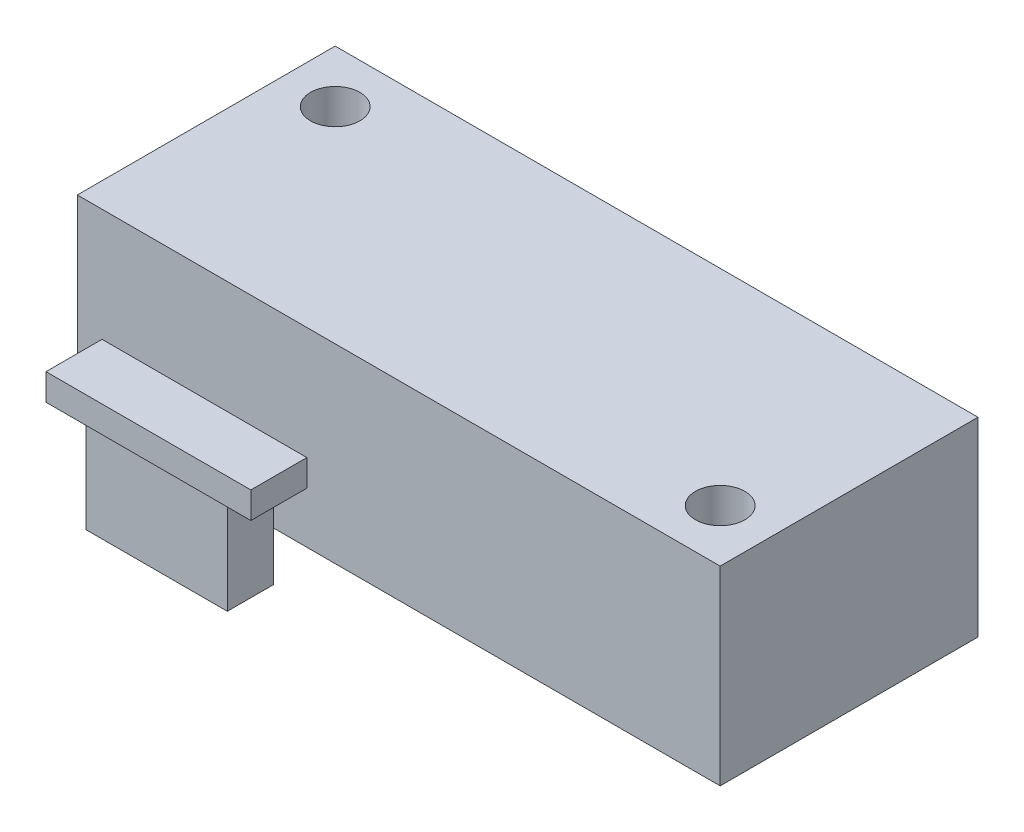
from build123d import *

# Parameters (mm, degrees)
SKETCH1_W           = 27.1018
SKETCH1_H           = 10.8712
SKETCH1_R           = 1.0414
BOSS_EXTRUDE4_DEPTH = 8.0264
SKETCH5_W           = 8.636
SKETCH5_H           = 2.3622
BOSS_EXTRUDE6_DEPTH = 1.1176
SKETCH6_W           = 5.969
SKETCH6_H           = 1.9558
BOSS_EXTRUDE7_DEPTH = 4.1656
SKETCH7_W           = 0.227948718
SKETCH7_H           = 2.54
CUT_EXTRUDE1_DEPTH  = 2.286


with BuildPart() as part:
    # Sketch1 → Boss-Extrude4 (new body)
    with BuildSketch(Plane(origin=(0, 0, 0), x_dir=(1, 0, 0), z_dir=(0, 1, 0))):
        with Locations((13.5509, 5.4356)):
            Rectangle(SKETCH1_W, SKETCH1_H)
        with Locations((2.2098, 8.6614)):
            Circle(SKETCH1_R, mode=Mode.SUBTRACT)
        with Locations((24.892, 2.2098)):
            Circle(SKETCH1_R, mode=Mode.SUBTRACT)
    extrude(amount=BOSS_EXTRUDE4_DEPTH)

    # Sketch5 → Boss-Extrude6 (add)
    with BuildSketch(Plane.XZ.offset(-2.159)):
        with Locations((5.3594, 1.1811)):
            Rectangle(SKETCH5_W, SKETCH5_H)
    extrude(amount=-BOSS_EXTRUDE6_DEPTH)

    # Sketch6 → Boss-Extrude7 (add)
    with BuildSketch(Plane.XZ.offset(-2.159)):
        with Locations((5.3467, 1.0287)):
            Rectangle(SKETCH6_W, SKETCH6_H)
    extrude(amount=BOSS_EXTRUDE7_DEPTH)

    # Sketch7 → Cut-Extrude1 (cut)
    # profile 1 of 12: a face of its own
    with BuildSketch(Plane.XZ):
        Polygon((5.244862276, -1.594756442), (5.244862276, -1.334243621), (6.579990481, -1.334243621), (6.579990481, -1.594756442), (6.026400737, -1.594756442), (6.026400737, -3.874243621), (5.798452019, -3.874243621), (5.798452019, -1.594756442), align=None)
    # profile 2 of 12: a face of its own
    with BuildSketch(Plane.XZ):
        Polygon((6.970759711, -1.334243621), (7.198708429, -1.334243621), (7.198708429, -2.376294903), (8.501272532, -2.376294903), (8.501272532, -1.334243621), (8.72922125, -1.334243621), (8.72922125, -3.874243621), (8.501272532, -3.874243621), (8.501272532, -2.636807724), (7.198708429, -2.636807724), (7.198708429, -3.874243621), (6.970759711, -3.874243621), align=None)
    # profile 3 of 12: a face of its own
    with BuildSketch(Plane.XZ):
        with Locations((9.49447766, -2.604243621)):
            Rectangle(SKETCH7_W, SKETCH7_H)
    # profile 4 of 12: a face of its own
    with BuildSketch(Plane.XZ):
        with BuildLine():
            Line((9.99922125, -3.38425564), (10.213940801, -3.255525672))
            add(Edge.make_bspline(
                [(10.213940801, -3.255525672), (10.233911179, -3.288955255), (10.272173652, -3.353005044), (10.33600121, -3.439552308), (10.402137666, -3.513112273), (10.471072782, -3.573257011), (10.542385784, -3.62060906), (10.616542212, -3.65413868), (10.693292166, -3.675050845), (10.745524597, -3.677590908), (10.771601058, -3.678859006)],
                knots=[0, 0, 0, 0, 1.272034388, 2.437168799, 3.508375237, 4.49857839, 5.41946034, 6.295179144, 7.148887113, 8, 8, 8, 8], degree=3))
            add(Edge.make_bspline(
                [(10.771601058, -3.678859006), (10.793870951, -3.678238758), (10.838021066, -3.677009114), (10.903017665, -3.665193904), (10.966141602, -3.647042245), (11.02609187, -3.621046483), (11.082041259, -3.589595125), (11.131104404, -3.551606756), (11.173519583, -3.509075395), (11.20821534, -3.461626269), (11.234834566, -3.410596109), (11.255293953, -3.35821699), (11.266647806, -3.303666087), (11.268358136, -3.266937351), (11.26922125, -3.248402275)],
                knots=[0, 0, 0, 0, 1.095163259, 2.171163733, 3.241058638, 4.321873601, 5.38011039, 6.391990106, 7.366004449, 8.327778327, 9.272591725, 10.192022065, 11.087607919, 12, 12, 12, 12], degree=3))
            add(Edge.make_bspline(
                [(11.26922125, -3.248402275), (11.268151322, -3.227254344), (11.265976314, -3.184263691), (11.247592897, -3.120836514), (11.218673729, -3.05806762), (11.191994553, -3.019240988), (11.178143526, -2.999083365)],
                knots=[0, 0, 0, 0, 0.938893495, 1.908633276, 2.914225137, 4, 4, 4, 4], degree=3))
            add(Edge.make_bspline(
                [(11.178143526, -2.999083365), (11.166771137, -2.984535098), (11.14289623, -2.953992833), (11.101851635, -2.908530291), (11.053688798, -2.861635781), (11.000055932, -2.811518637), (10.938999348, -2.760509779), (10.87243138, -2.7061768), (10.798652465, -2.650585941), (10.746909402, -2.613304136), (10.720210833, -2.594067339)],
                knots=[0, 0, 0, 0, 0.722233717, 1.516239348, 2.393582979, 3.351407094, 4.387010283, 5.505090956, 6.712668013, 8, 8, 8, 8], degree=3))
            add(Edge.make_bspline(
                [(10.720210833, -2.594067339), (10.693487133, -2.575032878), (10.642393454, -2.538640439), (10.570940654, -2.484629673), (10.507045529, -2.435249265), (10.450992072, -2.390034353), (10.402804936, -2.348978806), (10.362104403, -2.312476873), (10.329927279, -2.279541374), (10.312034372, -2.258175372), (10.304000897, -2.248582563)],
                knots=[0, 0, 0, 0, 1.452282411, 2.77665338, 3.964542531, 5.026858415, 5.96415736, 6.766646006, 7.446254459, 8, 8, 8, 8], degree=3))
            add(Edge.make_bspline(
                [(10.304000897, -2.248582563), (10.29277225, -2.233632097), (10.270689609, -2.204229997), (10.241540565, -2.158274243), (10.216765287, -2.111231074), (10.19734348, -2.062974075), (10.180988624, -2.014180726), (10.169988297, -1.964214394), (10.163100255, -1.913299282), (10.16239487, -1.87903577), (10.162041763, -1.861883845)],
                knots=[0, 0, 0, 0, 1.068054152, 2.10047183, 3.106115577, 4.101338837, 5.06977816, 6.043150881, 7.020423561, 8, 8, 8, 8], degree=3))
            add(Edge.make_bspline(
                [(10.162041763, -1.861883845), (10.162988972, -1.835010809), (10.164863143, -1.781839129), (10.180713119, -1.704165326), (10.20573059, -1.630007183), (10.24077888, -1.560098884), (10.285959931, -1.496260715), (10.338244723, -1.437758356), (10.400519345, -1.388577727), (10.468847249, -1.345606691), (10.54363673, -1.311972791), (10.622007271, -1.286601108), (10.704083432, -1.272225247), (10.759675421, -1.270162212), (10.787883109, -1.269115416)],
                knots=[0, 0, 0, 0, 1.005424448, 1.989358655, 2.955360095, 3.929531133, 4.905563448, 5.876582895, 6.856512386, 7.866279853, 8.892233794, 9.918561126, 10.94386622, 12, 12, 12, 12], degree=3))
            add(Edge.make_bspline(
                [(10.787883109, -1.269115416), (10.817814542, -1.270147782), (10.877338608, -1.272200829), (10.964895468, -1.290051608), (11.049194959, -1.319588667), (11.117008071, -1.353108436), (11.170081561, -1.386586664), (11.21055663, -1.41708105), (11.251572151, -1.452187558), (11.293458968, -1.491999696), (11.335507332, -1.536882767), (11.378341495, -1.586529381), (11.422061621, -1.640636139), (11.450187303, -1.67926192), (11.464605865, -1.699063333)],
                knots=[0, 0, 0, 0, 1.286793592, 2.559021753, 3.825965368, 5.121522368, 5.803751409, 6.523245864, 7.299691795, 8.125521123, 9.008227632, 9.944561021, 10.946284179, 12, 12, 12, 12], degree=3))
            Line((11.464605865, -1.699063333), (11.258536154, -1.855269262))
            add(Edge.make_bspline(
                [(11.258536154, -1.855269262), (11.246093106, -1.839239184), (11.222130704, -1.808369001), (11.185751019, -1.765137247), (11.151462001, -1.72564643), (11.117679711, -1.691345451), (11.086188332, -1.660355903), (11.055623393, -1.633823965), (11.02642475, -1.611489676), (10.989618763, -1.587654635), (10.943377905, -1.564027916), (10.885331984, -1.544035156), (10.82467223, -1.532020911), (10.783357583, -1.530432404), (10.762442404, -1.529628237)],
                knots=[0, 0, 0, 0, 1.181633172, 2.275549214, 3.290209073, 4.226197932, 5.078386478, 5.862611352, 6.581680152, 7.217281963, 8.414376989, 9.595101626, 10.782541182, 12, 12, 12, 12], degree=3))
            add(Edge.make_bspline(
                [(10.762442404, -1.529628237), (10.736203099, -1.530507584), (10.685603071, -1.532203324), (10.613764443, -1.550723542), (10.549107709, -1.579884092), (10.493552419, -1.620752676), (10.447297584, -1.669173054), (10.413838194, -1.724892566), (10.393699503, -1.786420367), (10.391242031, -1.829340311), (10.389990481, -1.851198749)],
                knots=[0, 0, 0, 0, 1.14458467, 2.207223713, 3.21896685, 4.227309161, 5.202851033, 6.127160689, 7.046193047, 8, 8, 8, 8], degree=3))
            add(Edge.make_bspline(
                [(10.389990481, -1.851198749), (10.390275778, -1.864806965), (10.39084684, -1.892045649), (10.398811408, -1.932287538), (10.409043492, -1.972427767), (10.425257859, -2.01228587), (10.447642737, -2.052558919), (10.477037921, -2.093940409), (10.514059011, -2.136795077), (10.542417757, -2.164667857), (10.55739032, -2.179383845)],
                knots=[0, 0, 0, 0, 0.858281714, 1.717966888, 2.583508476, 3.4729293, 4.427298488, 5.488583878, 6.674047936, 8, 8, 8, 8], degree=3))
            add(Edge.make_bspline(
                [(10.55739032, -2.179383845), (10.562950288, -2.184345573), (10.576159498, -2.196133501), (10.600308312, -2.215431899), (10.632198229, -2.23923734), (10.670996512, -2.268692135), (10.71741854, -2.302859825), (10.771469418, -2.341303532), (10.832546645, -2.385271265), (10.875887692, -2.416010737), (10.898804583, -2.432264454)],
                knots=[0, 0, 0, 0, 0.420754252, 0.999615792, 1.744751191, 2.668019286, 3.750313428, 4.999500688, 6.413464383, 8, 8, 8, 8], degree=3))
            add(Edge.make_bspline(
                [(10.898804583, -2.432264454), (10.926371503, -2.452324184), (10.979751023, -2.49116707), (11.055702524, -2.549525878), (11.124568316, -2.606601687), (11.186590184, -2.662030007), (11.242380854, -2.715390395), (11.291321372, -2.767324817), (11.333910408, -2.817461204), (11.37976047, -2.881739588), (11.426611002, -2.960683575), (11.466845696, -3.057405496), (11.492215468, -3.154503398), (11.495533082, -3.219764587), (11.497169968, -3.251963974)],
                knots=[0, 0, 0, 0, 1.163667725, 2.253281268, 3.268753668, 4.215851969, 5.092017293, 5.902905408, 6.650798638, 7.335211899, 8.59617414, 9.77448103, 10.901945474, 12, 12, 12, 12], degree=3))
            add(Edge.make_bspline(
                [(11.497169968, -3.251963974), (11.496693073, -3.274735702), (11.495748545, -3.319836946), (11.484891196, -3.386062058), (11.468983782, -3.450382747), (11.44500819, -3.512003954), (11.415745098, -3.57205301), (11.378613021, -3.628954744), (11.335572587, -3.68396853), (11.286199511, -3.735627407), (11.232173057, -3.783050075), (11.175071175, -3.825235165), (11.114800406, -3.86040932), (11.051687707, -3.889111931), (10.985718583, -3.911560827), (10.91691522, -3.927826166), (10.845164203, -3.937808882), (10.796395854, -3.938845029), (10.771601058, -3.939371826)],
                knots=[0, 0, 0, 0, 0.983748083, 1.948392443, 2.894712957, 3.844097841, 4.80183111, 5.778335162, 6.776009319, 7.81870978, 8.863265674, 9.881300176, 10.883814829, 11.87499822, 12.874611388, 13.892143829, 14.928324115, 16, 16, 16, 16], degree=3))
            add(Edge.make_bspline(
                [(10.771601058, -3.939371826), (10.752416552, -3.939000854), (10.714289149, -3.938263583), (10.657894267, -3.931745739), (10.60263868, -3.922524013), (10.549215744, -3.907883402), (10.496937165, -3.89012011), (10.446030315, -3.868248292), (10.396470521, -3.842037523), (10.347980047, -3.812069133), (10.300682217, -3.777192941), (10.255020661, -3.736572175), (10.209497195, -3.691327152), (10.165455484, -3.6402292), (10.122004688, -3.584103849), (10.080001499, -3.522425984), (10.038576481, -3.455531562), (10.012584685, -3.408458042), (9.99922125, -3.38425564)],
                knots=[0, 0, 0, 0, 0.915332311, 1.819136955, 2.706846663, 3.586547465, 4.459518054, 5.340707479, 6.227863349, 7.133153174, 8.059268498, 9.028702269, 10.047606654, 11.120612155, 12.245963614, 13.433783089, 14.680604001, 16, 16, 16, 16], degree=3))
        make_face()
    # profile 5 of 12: a face of its own
    with BuildSketch(Plane.XZ):
        with BuildLine():
            Line((12.995118686, -1.334243621), (13.493247692, -1.334243621))
            add(Edge.make_bspline(
                [(13.493247692, -1.334243621), (13.527509321, -1.334281283), (13.593156124, -1.334353445), (13.687292193, -1.336541289), (13.772788398, -1.339463517), (13.849460389, -1.343514376), (13.917544072, -1.348301616), (13.976731369, -1.355015953), (14.027487504, -1.362026568), (14.057899613, -1.369154103), (14.071769327, -1.372404679)],
                knots=[0, 0, 0, 0, 1.415646017, 2.712440637, 3.8905458, 4.950247383, 5.884950622, 6.709939814, 7.411656543, 8, 8, 8, 8], degree=3))
            add(Edge.make_bspline(
                [(14.071769327, -1.372404679), (14.08932692, -1.377210322), (14.124028383, -1.386708371), (14.174030855, -1.405732044), (14.221604217, -1.428288816), (14.266911691, -1.453996475), (14.309396517, -1.483957998), (14.349692558, -1.516958852), (14.387444201, -1.553760962), (14.422439154, -1.593951556), (14.454577264, -1.636855937), (14.482248519, -1.683114584), (14.505418564, -1.731948844), (14.525290995, -1.78332475), (14.539593702, -1.837673728), (14.55036831, -1.894618142), (14.557207171, -1.954151888), (14.557862173, -1.994835335), (14.558195609, -2.015545704)],
                knots=[0, 0, 0, 0, 0.999701418, 1.975846123, 2.934577507, 3.890451536, 4.834027766, 5.787354733, 6.749476667, 7.726910423, 8.712836071, 9.690891519, 10.682875813, 11.679750201, 12.712814741, 13.765529915, 14.8625177, 16, 16, 16, 16], degree=3))
            add(Edge.make_bspline(
                [(14.558195609, -2.015545704), (14.557889775, -2.036430148), (14.55729139, -2.077291973), (14.550109515, -2.137071082), (14.540435604, -2.194198142), (14.5255606, -2.248546486), (14.506078312, -2.29979336), (14.483224079, -2.348721911), (14.455658889, -2.39449973), (14.423985212, -2.43729301), (14.388750627, -2.477141917), (14.350104209, -2.513757683), (14.308201979, -2.546925974), (14.263177106, -2.576721149), (14.214590644, -2.602452278), (14.163179481, -2.625499007), (14.108496753, -2.644854577), (14.070656186, -2.655036393), (14.051416763, -2.660213172)],
                knots=[0, 0, 0, 0, 1.121902311, 2.195077645, 3.232258892, 4.234102512, 5.217864754, 6.176164875, 7.132989551, 8.084763148, 9.034132444, 9.988522005, 10.94243251, 11.903244335, 12.886203696, 13.894208494, 14.929344452, 16, 16, 16, 16], degree=3))
            add(Edge.make_bspline(
                [(14.051416763, -2.660213172), (14.035503783, -2.663597164), (14.000629563, -2.67101338), (13.943194559, -2.67929266), (13.876323336, -2.686359376), (13.800107167, -2.691657915), (13.714614465, -2.696193897), (13.619798981, -2.699799314), (13.515474594, -2.701780408), (13.442706319, -2.701882583), (13.404714038, -2.701935929)],
                knots=[0, 0, 0, 0, 0.601384939, 1.31797006, 2.144135048, 3.087295005, 4.142315834, 5.309527816, 6.595305764, 8, 8, 8, 8], degree=3))
            Line((13.404714038, -2.701935929), (13.223067404, -2.701935929))
            Line((13.223067404, -2.701935929), (13.223067404, -3.874243621))
            Line((13.223067404, -3.874243621), (12.995118686, -3.874243621))
            Line((12.995118686, -3.874243621), (12.995118686, -1.334243621))
        make_face()
        with BuildLine():
            Line((13.223067404, -1.594756442), (13.223067404, -2.441423108))
            Line((13.223067404, -2.441423108), (13.667770929, -2.447020063))
            add(Edge.make_bspline(
                [(13.667770929, -2.447020063), (13.689484247, -2.447031286), (13.731401359, -2.44705295), (13.791952218, -2.444160816), (13.848129244, -2.440822144), (13.899759878, -2.435933788), (13.946867397, -2.429024075), (13.989530346, -2.4220487), (14.027417917, -2.41195738), (14.071758481, -2.398369781), (14.121167539, -2.375195825), (14.174919417, -2.341559048), (14.220472928, -2.298683334), (14.259892492, -2.250475708), (14.291175043, -2.196846054), (14.314075678, -2.139464597), (14.32753126, -2.078919815), (14.329335527, -2.037490137), (14.330246891, -2.016563333)],
                knots=[0, 0, 0, 0, 1.160613943, 2.240541288, 3.23993089, 4.169200891, 5.011653406, 5.7853311, 6.478053781, 7.106038997, 8.262395093, 9.384106736, 10.481365981, 11.59014053, 12.70357646, 13.786202915, 14.881775077, 16, 16, 16, 16], degree=3))
            add(Edge.make_bspline(
                [(14.330246891, -2.016563333), (14.32933057, -1.996142811), (14.327509038, -1.955549343), (14.313970212, -1.896056185), (14.291219567, -1.839279417), (14.259682496, -1.786321806), (14.221407504, -1.738287646), (14.176921695, -1.696561159), (14.126329786, -1.663017409), (14.079268498, -1.64136697), (14.037466494, -1.628147885), (14.001157586, -1.618898772), (13.960161497, -1.611514189), (13.91446488, -1.605534664), (13.86442192, -1.600415867), (13.809602686, -1.596942615), (13.750214842, -1.594909558), (13.708986599, -1.594808716), (13.687614679, -1.594756442)],
                knots=[0, 0, 0, 0, 1.120700087, 2.227813068, 3.331159281, 4.466773991, 5.599788987, 6.693661531, 7.80175334, 8.91857717, 9.525282508, 10.207424825, 10.974604443, 11.810962634, 12.737642355, 13.736264703, 14.826523623, 16, 16, 16, 16], degree=3))
            Line((13.687614679, -1.594756442), (13.223067404, -1.594756442))
        make_face(mode=Mode.SUBTRACT)
    # profile 6 of 12: a face of its own
    with BuildSketch(Plane.XZ):
        Polygon((16.121272532, -1.334243621), (17.293580224, -3.874243621), (17.045787756, -3.874243621), (16.670282949, -3.060141057), (15.518836635, -3.060141057), (15.132646731, -3.874243621), (14.883836635, -3.874243621), (16.088708429, -1.334243621), align=None)
        Polygon((16.10244641, -1.829319743), (15.642478461, -2.799628237), (16.55020282, -2.799628237), align=None, mode=Mode.SUBTRACT)
    # profile 7 of 12: a face of its own
    with BuildSketch(Plane.XZ):
        with BuildLine():
            Line((17.74947766, -1.334243621), (18.257782949, -1.334243621))
            add(Edge.make_bspline(
                [(18.257782949, -1.334243621), (18.291703653, -1.334356532), (18.356835164, -1.334573334), (18.450142623, -1.335782202), (18.534925716, -1.33924702), (18.611140114, -1.342228677), (18.678784418, -1.347665686), (18.738066052, -1.35286227), (18.788711981, -1.35966487), (18.819370398, -1.36598252), (18.833251699, -1.36884298)],
                knots=[0, 0, 0, 0, 1.410062039, 2.707475311, 3.878576406, 4.937260626, 5.877586885, 6.699081471, 7.410979367, 8, 8, 8, 8], degree=3))
            add(Edge.make_bspline(
                [(18.833251699, -1.36884298), (18.851834792, -1.373434404), (18.88860455, -1.382519305), (18.941545455, -1.401721415), (18.991992993, -1.423942514), (19.039737608, -1.4500419), (19.084540154, -1.480213311), (19.126862585, -1.513935891), (19.16689695, -1.551025121), (19.20302419, -1.59241612), (19.23708853, -1.63584033), (19.265818562, -1.68279677), (19.290584636, -1.731899708), (19.310302668, -1.783648519), (19.326179826, -1.837541348), (19.337374869, -1.894066361), (19.344088588, -1.95296604), (19.344772106, -1.993140065), (19.345118686, -2.013510448)],
                knots=[0, 0, 0, 0, 1.027469482, 2.033020251, 3.019912614, 3.986113645, 4.951240523, 5.91722682, 6.890402269, 7.87763091, 8.8651537, 9.85103654, 10.82876324, 11.815024772, 12.821070561, 13.842952187, 14.906261191, 16, 16, 16, 16], degree=3))
            add(Edge.make_bspline(
                [(19.345118686, -2.013510448), (19.344052613, -2.04735421), (19.341972429, -2.113392154), (19.322577639, -2.209230623), (19.290808393, -2.298630868), (19.247030921, -2.381480325), (19.19128193, -2.456164051), (19.12428051, -2.521761696), (19.045989283, -2.576654661), (18.973106294, -2.61472041), (18.908725132, -2.639099264), (18.855723814, -2.656252507), (18.79790835, -2.669505476), (18.735832684, -2.681378258), (18.669238488, -2.690342059), (18.598285374, -2.696907302), (18.522922738, -2.701010526), (18.471150957, -2.701621581), (18.444517724, -2.701935929)],
                knots=[0, 0, 0, 0, 1.260483769, 2.459530307, 3.627416485, 4.787058657, 5.939039949, 7.08810263, 8.267026773, 9.491475466, 10.141966685, 10.831826277, 11.566392101, 12.351337768, 13.187381173, 14.07005841, 15.007169909, 16, 16, 16, 16], degree=3))
            Line((18.444517724, -2.701935929), (19.377682788, -3.874243621))
            Line((19.377682788, -3.874243621), (19.095799776, -3.874243621))
            Line((19.095799776, -3.874243621), (18.162634711, -2.701935929))
            Line((18.162634711, -2.701935929), (17.977426378, -2.701935929))
            Line((17.977426378, -2.701935929), (17.977426378, -3.874243621))
            Line((17.977426378, -3.874243621), (17.74947766, -3.874243621))
            Line((17.74947766, -3.874243621), (17.74947766, -1.334243621))
        make_face()
        with BuildLine():
            Line((17.977426378, -1.594756442), (17.977426378, -2.441423108))
            Line((17.977426378, -2.441423108), (18.442482468, -2.444984807))
            add(Edge.make_bspline(
                [(18.442482468, -2.444984807), (18.464195868, -2.444994413), (18.50628262, -2.445013032), (18.567170531, -2.442114692), (18.623863413, -2.438817541), (18.676144416, -2.433774302), (18.724036896, -2.427274752), (18.767516916, -2.419144587), (18.806655451, -2.409672518), (18.852301818, -2.39501191), (18.903273473, -2.371784685), (18.958668304, -2.337991438), (19.005841429, -2.295486991), (19.045696106, -2.246883397), (19.077721465, -2.19344452), (19.100299927, -2.135810926), (19.114627299, -2.075437595), (19.116317158, -2.033942625), (19.117169968, -2.013001634)],
                knots=[0, 0, 0, 0, 1.146690395, 2.22261258, 3.21895312, 4.145990853, 4.996080663, 5.770904154, 6.481378293, 7.121626537, 8.300444488, 9.431385265, 10.535395872, 11.636531494, 12.74115979, 13.810798291, 14.895190096, 16, 16, 16, 16], degree=3))
            add(Edge.make_bspline(
                [(19.117169968, -2.013001634), (19.116297571, -1.992575263), (19.1145688, -1.95209765), (19.100454551, -1.892838789), (19.076586257, -1.836910203), (19.044420976, -1.784539405), (19.005233018, -1.737000957), (18.959282376, -1.696326737), (18.907825463, -1.66276284), (18.859731508, -1.641314804), (18.816744394, -1.628164967), (18.779421155, -1.618911266), (18.737248825, -1.611476708), (18.690022635, -1.605520001), (18.637944195, -1.600400127), (18.580750179, -1.596951694), (18.518820059, -1.594909632), (18.475896286, -1.594808694), (18.453676378, -1.594756442)],
                knots=[0, 0, 0, 0, 1.101028733, 2.181837193, 3.264309656, 4.369019818, 5.486613113, 6.575447106, 7.666700264, 8.788928104, 9.402425223, 10.0903467, 10.862060571, 11.710948788, 12.657782767, 13.684531032, 14.801375019, 16, 16, 16, 16], degree=3))
            Line((18.453676378, -1.594756442), (17.977426378, -1.594756442))
        make_face(mode=Mode.SUBTRACT)
    # profile 8 of 12: a face of its own
    with BuildSketch(Plane.XZ):
        Polygon((19.605631506, -1.594756442), (19.605631506, -1.334243621), (20.940759711, -1.334243621), (20.940759711, -1.594756442), (20.387169968, -1.594756442), (20.387169968, -3.874243621), (20.15922125, -3.874243621), (20.15922125, -1.594756442), align=None)
    # profile 9 of 12: a face of its own
    with BuildSketch(Plane.XZ):
        with BuildLine():
            Line((5.537939199, -9.107576954), (5.537939199, -6.567576954))
            Line((5.537939199, -6.567576954), (6.050823814, -6.567576954))
            add(Edge.make_bspline(
                [(6.050823814, -6.567576954), (6.095432737, -6.567898134), (6.181616944, -6.568518651), (6.306158548, -6.572453032), (6.421390193, -6.57941297), (6.526932897, -6.589550854), (6.623076405, -6.601999056), (6.709551509, -6.617602207), (6.78680535, -6.636026765), (6.834317458, -6.651735177), (6.856785353, -6.659163493)],
                knots=[0, 0, 0, 0, 1.314313732, 2.53924729, 3.670748893, 4.714932338, 5.66265055, 6.526160246, 7.303039223, 8, 8, 8, 8], degree=3))
            add(Edge.make_bspline(
                [(6.856785353, -6.659163493), (6.886172963, -6.670361776), (6.944281771, -6.692504404), (7.027018369, -6.734273834), (7.104905918, -6.781599913), (7.178362097, -6.834545025), (7.245708983, -6.894608295), (7.309577571, -6.959238294), (7.367355113, -7.030785261), (7.420265705, -7.107765395), (7.467971012, -7.189271856), (7.509437716, -7.275149335), (7.543875756, -7.364961709), (7.572463984, -7.458459216), (7.594994841, -7.555847445), (7.610366872, -7.657239793), (7.620505819, -7.762235548), (7.621524759, -7.833482159), (7.622041763, -7.869632243)],
                knots=[0, 0, 0, 0, 0.984719456, 1.947108742, 2.898477687, 3.838006223, 4.779231079, 5.722358779, 6.681677486, 7.655904652, 8.64651281, 9.637519902, 10.640069247, 11.656948941, 12.698408672, 13.768548281, 14.867775369, 16, 16, 16, 16], degree=3))
            add(Edge.make_bspline(
                [(7.622041763, -7.869632243), (7.621585312, -7.901027542), (7.620685828, -7.962895257), (7.612609125, -8.05407465), (7.600869738, -8.14254907), (7.582694806, -8.227897207), (7.560631268, -8.310866828), (7.532354427, -8.390573657), (7.499961809, -8.467748878), (7.462188469, -8.541348989), (7.42072015, -8.611078065), (7.376218084, -8.67681002), (7.32872974, -8.737606895), (7.27780228, -8.793652802), (7.224093823, -8.844863251), (7.167252738, -8.891666027), (7.107132352, -8.933145356), (7.044001942, -8.9709312), (6.976019837, -9.003893401), (6.90189838, -9.031782608), (6.821321468, -9.054894152), (6.734486882, -9.07417703), (6.641244587, -9.08947313), (6.541503166, -9.099724855), (6.435415864, -9.106657555), (6.362569197, -9.107264537), (6.325074615, -9.107576954)],
                knots=[0, 0, 0, 0, 1.105936401, 2.179363191, 3.223086493, 4.248585256, 5.251745608, 6.245858792, 7.225916811, 8.198733463, 9.158002045, 10.082870192, 10.993790845, 11.873723703, 12.748670949, 13.606408763, 14.465103618, 15.319838547, 16.196477973, 17.123216899, 18.106603292, 19.147568657, 20.255746949, 21.433717677, 22.679120308, 24, 24, 24, 24], degree=3))
            Line((6.325074615, -9.107576954), (5.537939199, -9.107576954))
        make_face()
        with BuildLine():
            Line((5.765887917, -8.847064134), (6.057438397, -8.847064134))
            add(Edge.make_bspline(
                [(6.057438397, -8.847064134), (6.099332701, -8.846884087), (6.179910789, -8.84653779), (6.295776878, -8.843499077), (6.40164364, -8.838533785), (6.497526107, -8.831585015), (6.583370142, -8.82239122), (6.659355149, -8.812140576), (6.725232051, -8.799369855), (6.765095128, -8.787794015), (6.783516122, -8.782444743)],
                knots=[0, 0, 0, 0, 1.375205317, 2.645023457, 3.804390687, 4.853969522, 5.800190428, 6.637939096, 7.370582563, 8, 8, 8, 8], degree=3))
            add(Edge.make_bspline(
                [(6.783516122, -8.782444743), (6.806701504, -8.774279326), (6.852518488, -8.758143524), (6.918472189, -8.72871025), (6.979981559, -8.693845434), (7.038118548, -8.65509064), (7.092058464, -8.61107897), (7.142440537, -8.562767453), (7.18916333, -8.509910216), (7.231744113, -8.452572865), (7.26985014, -8.39111227), (7.302849261, -8.326132659), (7.331770086, -8.258346003), (7.354469408, -8.186711356), (7.372260718, -8.111869125), (7.38486252, -8.033814045), (7.39271092, -7.952560692), (7.39362637, -7.897296007), (7.394093045, -7.869123429)],
                knots=[0, 0, 0, 0, 0.998632004, 1.973411704, 2.929992603, 3.868527914, 4.809262121, 5.754881198, 6.702106254, 7.672490631, 8.653608572, 9.636854334, 10.631411391, 11.644891563, 12.686317036, 13.754757253, 14.855430412, 16, 16, 16, 16], degree=3))
            add(Edge.make_bspline(
                [(7.394093045, -7.869123429), (7.393720545, -7.839417417), (7.392988765, -7.781059695), (7.383790837, -7.695432162), (7.37034948, -7.613077633), (7.350912176, -7.533990599), (7.32614291, -7.458016767), (7.29523137, -7.385576322), (7.259913309, -7.315904217), (7.21789203, -7.250608535), (7.171870428, -7.18885525), (7.120796196, -7.132282254), (7.065480774, -7.080760676), (7.006527483, -7.033488146), (6.942274845, -6.992366507), (6.874236452, -6.955582459), (6.801414165, -6.924365212), (6.750750095, -6.907761694), (6.7250025, -6.899323749)],
                knots=[0, 0, 0, 0, 1.122418816, 2.205001699, 3.251619955, 4.274784885, 5.280384055, 6.268708349, 7.249350384, 8.229342522, 9.199999885, 10.157847722, 11.105861043, 12.055065948, 13.010012805, 13.98527497, 14.976112212, 16, 16, 16, 16], degree=3))
            add(Edge.make_bspline(
                [(6.7250025, -6.899323749), (6.703701954, -6.893433542), (6.658411148, -6.880909344), (6.584504794, -6.867247502), (6.501326943, -6.85519738), (6.408508303, -6.84499526), (6.306154678, -6.837674747), (6.19418735, -6.832180136), (6.072557923, -6.82847418), (5.988242598, -6.828221118), (5.944481667, -6.828089775)],
                knots=[0, 0, 0, 0, 0.674548936, 1.434276114, 2.292660221, 3.240891867, 4.284742987, 5.42552168, 6.663806718, 8, 8, 8, 8], degree=3))
            Line((5.944481667, -6.828089775), (5.765887917, -6.828089775))
            Line((5.765887917, -6.828089775), (5.765887917, -8.847064134))
        make_face(mode=Mode.SUBTRACT)
    # profile 10 of 12: a face of its own
    with BuildSketch(Plane.XZ):
        with BuildLine():
            add(Edge.make_bspline(
                [(9.331657147, -6.502448749), (9.378689316, -6.503639994), (9.471064375, -6.505979698), (9.6068273, -6.523889676), (9.736436312, -6.55487433), (9.860947213, -6.596140609), (9.978870687, -6.65118922), (10.091094341, -6.717726442), (10.197351158, -6.796449358), (10.29620896, -6.886749425), (10.38667429, -6.984999132), (10.466376505, -7.089848815), (10.533172912, -7.200664517), (10.588026598, -7.317113235), (10.631060446, -7.438931611), (10.66075598, -7.566769088), (10.679724809, -7.699797371), (10.681942431, -7.790531153), (10.683067404, -7.836559326)],
                knots=[0, 0, 0, 0, 1.065120563, 2.091984664, 3.0946048, 4.079830382, 5.057816894, 6.036188127, 7.030412546, 8.04752943, 9.064399622, 10.05169764, 11.02544977, 11.989514704, 12.962713494, 13.945757189, 14.957906945, 16, 16, 16, 16], degree=3))
            add(Edge.make_bspline(
                [(10.683067404, -7.836559326), (10.681942596, -7.882248444), (10.679725468, -7.97230699), (10.660734413, -8.104491089), (10.630950373, -8.231556909), (10.588426225, -8.353292325), (10.533834021, -8.469825757), (10.46659284, -8.580850575), (10.387387504, -8.686403177), (10.297248818, -8.785327225), (10.198986347, -8.876039676), (10.093590668, -8.95508366), (9.983432087, -9.023100596), (9.867093042, -9.077372176), (9.746116443, -9.120749513), (9.619419558, -9.150324279), (9.487596058, -9.169401162), (9.397701101, -9.171591742), (9.352009711, -9.17270516)],
                knots=[0, 0, 0, 0, 1.043624062, 2.057103931, 3.04512605, 4.022047818, 4.998200453, 5.980619268, 6.982898556, 8.009068085, 9.034988726, 10.034168286, 11.015286542, 11.987931943, 12.962482838, 13.94673481, 14.956375938, 16, 16, 16, 16], degree=3))
            add(Edge.make_bspline(
                [(9.352009711, -9.17270516), (9.305981777, -9.171580747), (9.215248466, -9.169364232), (9.082053018, -9.150364012), (8.954125741, -9.120652323), (8.831832469, -9.078191189), (8.715105005, -9.023314685), (8.60371506, -8.95640065), (8.498109736, -8.877002324), (8.399164583, -8.786892867), (8.308632307, -8.688796941), (8.229704075, -8.583688653), (8.162774992, -8.473630122), (8.108082745, -8.358315919), (8.064783395, -8.2383035), (8.035243327, -8.112792319), (8.01613095, -7.982497935), (8.013928519, -7.893784518), (8.012810994, -7.848770865)],
                knots=[0, 0, 0, 0, 1.053102029, 2.075944431, 3.073151272, 4.055350789, 5.033113405, 6.020478099, 7.024410459, 8.052272461, 9.079885166, 10.07527673, 11.055994387, 12.023226415, 12.992069828, 13.970394897, 14.97016774, 16, 16, 16, 16], degree=3))
            add(Edge.make_bspline(
                [(8.012810994, -7.848770865), (8.013198986, -7.818557442), (8.013970077, -7.758511752), (8.023253191, -7.669345705), (8.036723682, -7.581613628), (8.05602907, -7.495564997), (8.08127788, -7.411410454), (8.111069923, -7.328569615), (8.147457125, -7.247881998), (8.188591081, -7.168965365), (8.234501079, -7.093049914), (8.285210908, -7.021291587), (8.338939433, -6.953088236), (8.397840867, -6.890207267), (8.459973944, -6.830819414), (8.526346596, -6.775837327), (8.596553825, -6.72476522), (8.670897723, -6.678740173), (8.747546414, -6.637113829), (8.826559847, -6.601392829), (8.906864902, -6.570734258), (8.988837704, -6.545885202), (9.072260572, -6.526267668), (9.157315582, -6.512909188), (9.243934971, -6.503602398), (9.302290614, -6.502834953), (9.331657147, -6.502448749)],
                knots=[0, 0, 0, 0, 1.037015668, 2.060948919, 3.074880161, 4.083647147, 5.086022904, 6.090072063, 7.104153813, 8.122640571, 9.144368836, 10.147691507, 11.138137339, 12.123020368, 13.103399296, 14.087645067, 15.080126199, 16.082011238, 17.087798457, 18.072939717, 19.057185487, 20.037253025, 21.01195951, 21.997135196, 22.992090687, 24, 24, 24, 24], degree=3))
        make_face()
        with BuildLine():
            add(Edge.make_bspline(
                [(9.342851058, -6.76296157), (9.318746724, -6.763255404), (9.270768495, -6.763840265), (9.199442003, -6.771544241), (9.129053571, -6.782524218), (9.059588662, -6.798186236), (8.991337926, -6.819525177), (8.923665184, -6.844084007), (8.85718754, -6.873998742), (8.792124454, -6.907797218), (8.729048942, -6.945207007), (8.669531153, -6.986552232), (8.613417006, -7.030863297), (8.560843893, -7.078243613), (8.511966185, -7.128934467), (8.465821859, -7.182167378), (8.424260505, -7.239463893), (8.386170972, -7.299270303), (8.352085739, -7.361508707), (8.321776025, -7.425523865), (8.296982716, -7.491837957), (8.276762591, -7.559731546), (8.259998728, -7.629097102), (8.249378681, -7.700460833), (8.241590054, -7.773464143), (8.241038623, -7.822799545), (8.240759711, -7.847753237)],
                knots=[0, 0, 0, 0, 1.008559885, 2.007477868, 2.99961109, 3.989939068, 4.984837346, 5.991145699, 7.001802488, 8.033829008, 9.059044045, 10.069351652, 11.065060232, 12.050310815, 13.029377138, 14.011219647, 14.996725999, 15.989392538, 16.977580475, 17.965360261, 18.951710183, 19.937753436, 20.929683414, 21.935841486, 22.955955122, 24, 24, 24, 24], degree=3))
            add(Edge.make_bspline(
                [(8.240759711, -7.847753237), (8.241684897, -7.884446962), (8.243505023, -7.956634873), (8.259439945, -8.062420897), (8.283985036, -8.164084968), (8.320167239, -8.261070811), (8.36541597, -8.35421209), (8.421315485, -8.442682543), (8.487543507, -8.526506081), (8.562773609, -8.605097505), (8.645013516, -8.676831317), (8.732340698, -8.739796762), (8.823819601, -8.793071629), (8.919688783, -8.836473024), (9.019436425, -8.870864434), (9.123705277, -8.894434641), (9.231800753, -8.909947114), (9.305483, -8.911436828), (9.342851058, -8.912192339)],
                knots=[0, 0, 0, 0, 1.032063989, 2.030389145, 3.003944642, 3.970395727, 4.937377036, 5.913328081, 6.909231446, 7.93887556, 8.970685674, 9.976071282, 10.964166581, 11.944589148, 12.933237628, 13.927779006, 14.949070134, 16, 16, 16, 16], degree=3))
            add(Edge.make_bspline(
                [(9.342851058, -8.912192339), (9.367967667, -8.911847259), (9.417781448, -8.911162861), (9.491873627, -8.904269535), (9.564630992, -8.89321555), (9.635951492, -8.87730016), (9.705754184, -8.85738133), (9.774330413, -8.833717436), (9.840949743, -8.804194506), (9.906452597, -8.771575135), (9.969151584, -8.734389421), (10.029005256, -8.694447449), (10.084504967, -8.65020165), (10.13703875, -8.603525295), (10.18611713, -8.553477245), (10.231408222, -8.50012257), (10.272759518, -8.443124493), (10.310834587, -8.383408799), (10.344800383, -8.321000089), (10.374394358, -8.256752837), (10.399501254, -8.190825244), (10.419769368, -8.123122218), (10.435651961, -8.053772345), (10.446595674, -7.982682768), (10.454250827, -7.909995702), (10.454827825, -7.860833018), (10.455118686, -7.836050512)],
                knots=[0, 0, 0, 0, 1.047197238, 2.076906641, 3.100256066, 4.114471768, 5.12198147, 6.126382909, 7.136867548, 8.15857795, 9.17633901, 10.174870724, 11.156907918, 12.133735059, 13.104061851, 14.077631395, 15.04955518, 16.038496417, 17.029181396, 18.010275684, 18.986308667, 19.968651475, 20.955262928, 21.950658345, 22.966943676, 24, 24, 24, 24], degree=3))
            add(Edge.make_bspline(
                [(10.455118686, -7.836050512), (10.454827592, -7.811437546), (10.454250155, -7.762613194), (10.446599331, -7.690433058), (10.435640399, -7.619855013), (10.419846891, -7.551156139), (10.399490493, -7.484318923), (10.374389974, -7.419406141), (10.344791499, -7.356175965), (10.310822102, -7.294784675), (10.272638047, -7.235875008), (10.230913653, -7.179557829), (10.184928515, -7.126890753), (10.135996486, -7.076573575), (10.082895329, -7.02967945), (10.025865584, -6.986192821), (9.965599601, -6.945064216), (9.90178955, -6.907961665), (9.835935366, -6.873697622), (9.768361237, -6.844341751), (9.69983269, -6.819397413), (9.630523992, -6.798121673), (9.559851773, -6.782585559), (9.488293566, -6.771534346), (9.415948372, -6.763842946), (9.36729415, -6.763256294), (9.342851058, -6.76296157)],
                knots=[0, 0, 0, 0, 1.02996197, 2.043119294, 3.035359645, 4.018872909, 4.991431989, 5.957985074, 6.929999688, 7.912076566, 8.892894881, 9.867085534, 10.843653904, 11.817741046, 12.803660682, 13.806313499, 14.818574707, 15.856120519, 16.894564902, 17.924820532, 18.937903209, 19.946497019, 20.957711757, 21.963978472, 22.977135795, 24, 24, 24, 24], degree=3))
        make_face(mode=Mode.SUBTRACT)
    # profile 11 of 12: a face of its own
    with BuildSketch(Plane.XZ):
        Polygon((11.041272532, -6.567576954), (11.276853461, -6.567576954), (11.77396484, -8.430345384), (12.513271731, -6.567576954), (12.546344647, -6.567576954), (13.271913558, -8.417625031), (13.771569006, -6.567576954), (14.004605865, -6.567576954), (13.319742083, -9.107576954), (13.287177981, -9.107576954), (12.522939199, -7.164924711), (11.749541763, -9.107576954), (11.71697766, -9.107576954), align=None)
    # profile 12 of 12: a face of its own
    with BuildSketch(Plane.XZ):
        Polygon((14.460503301, -9.107576954), (14.460503301, -6.567576954), (14.508331827, -6.567576954), (16.186400737, -8.566707563), (16.186400737, -6.567576954), (16.414349455, -6.567576954), (16.414349455, -9.107576954), (16.362450417, -9.107576954), (14.688452019, -7.113025672), (14.688452019, -9.107576954), align=None)
    extrude(amount=-CUT_EXTRUDE1_DEPTH, mode=Mode.SUBTRACT)


solid = part.part
